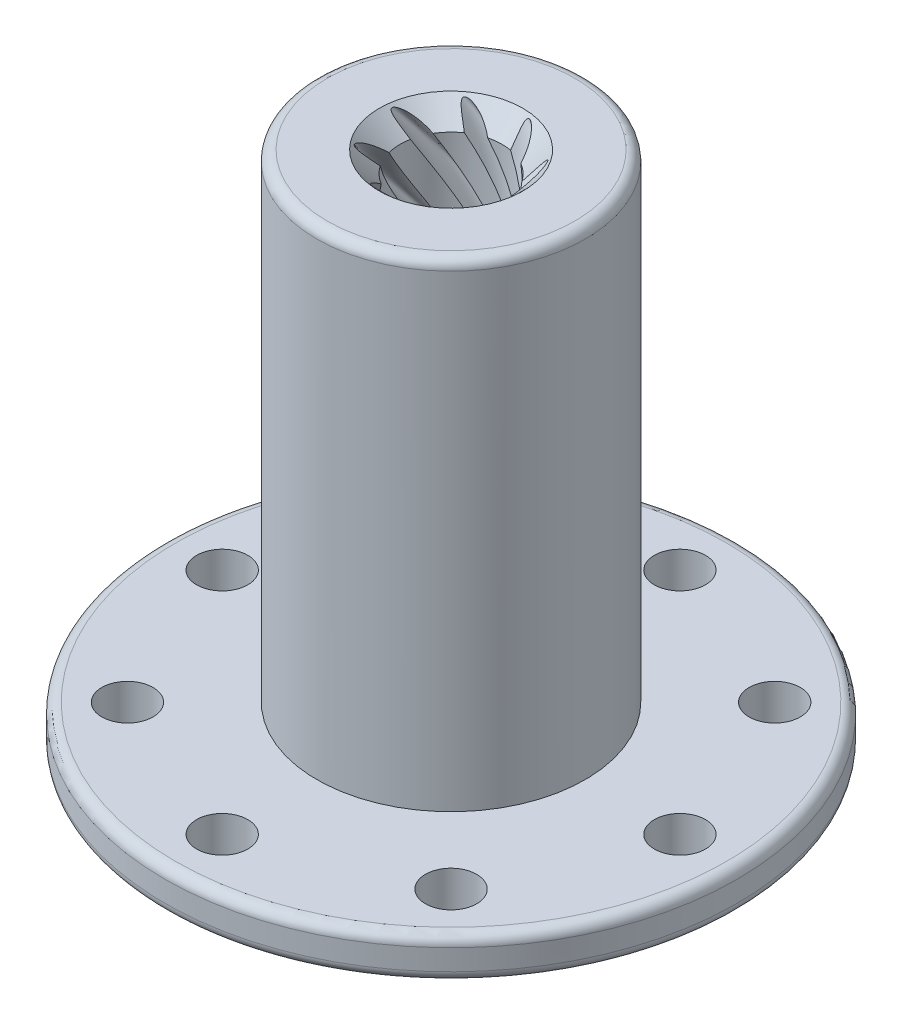
from build123d import *

# Parameters (mm, degrees)
CONG_1_R                                    = 0.5
ESQUISSE8_R                                 = 1.23
ENL_V_MAT_EXTRU_2_DEPTH                     = 31.118515945
R_P_TITION_CIRCULAIRE2_COUNT                = 8
ENL_VEMENT_DE_MATI_RE_BALAYAGE1_PITCH       = 25.4
ENL_VEMENT_DE_MATI_RE_BALAYAGE1_HEIGHT      = 25
ENL_VEMENT_DE_MATI_RE_BALAYAGE1_RADIUS      = 3.325
ENL_VEMENT_DE_MATI_RE_BALAYAGE1_START_ANGLE = 180
R_P_TITION_CIRCULAIRE1_COUNT                = 8


with BuildPart() as part:
    # Esquisse1 → Révolution2 (revolve)
    with BuildSketch(Plane.XY):
        Polygon((6.45, 25), (6.45, 2), (13.75, 2), (13.75, 0), (2.45, 0), (2.45, 24), (3.45, 25), align=None)
    revolve(axis=Axis((0, 0, 0), (0, 1, 0)))

    # Congé1
    cong_1_edges = [part.edges().sort_by_distance(p)[0] for p in [
        (-13.75, 0, 0),
        (-13.75, 2, 0),
        (-6.45, 25, 0),
    ]]
    fillet(cong_1_edges, radius=CONG_1_R)

    # Esquisse8 → Enlèv. mat.-Extru.2 (cut, through all)
    with BuildSketch(Plane(origin=(0, 2, 0), x_dir=(1, 0, 0), z_dir=(0, 1, 0))):
        with Locations((11, 0)):
            Circle(ESQUISSE8_R)
    enl_v_mat_extru_2 = extrude(amount=-ENL_V_MAT_EXTRU_2_DEPTH, mode=Mode.SUBTRACT)

    # Répétition circulaire2: Enlèv. mat.-Extru.2 ×8 about axis
    r_p_tition_circulaire2_axis = Axis((0, 0, 0), (0, -1, 0))
    for i in range(1, R_P_TITION_CIRCULAIRE2_COUNT):
        add(enl_v_mat_extru_2.rotate(r_p_tition_circulaire2_axis, i * 360 / R_P_TITION_CIRCULAIRE2_COUNT), mode=Mode.SUBTRACT)

    # Enlèvement de matière-Balayage1: sweep along a helix
    with BuildLine() as enl_vement_de_mati_re_balayage1_path:
        add(Helix(ENL_VEMENT_DE_MATI_RE_BALAYAGE1_PITCH, ENL_VEMENT_DE_MATI_RE_BALAYAGE1_HEIGHT, ENL_VEMENT_DE_MATI_RE_BALAYAGE1_RADIUS, center=(0, 0, 0), direction=(0, 1, 0), mode=Mode.PRIVATE).rotate(Axis((0, 0, 0), (0, 1, 0)), ENL_VEMENT_DE_MATI_RE_BALAYAGE1_START_ANGLE))
    # Esquisse11 → Enlèvement de matière-Balayage1 (sweep, cut)
    with BuildSketch(Plane.XY):
        with BuildLine():
            Line((2.324477405, 19.852026425), (2.324477405, 18.352026425))
            add(Edge.make_bspline(
                [(2.324477405, 18.352026425), (4.324477405, 19.102026425), (2.324477405, 19.852026425)],
                knots=[0, 0, 0, 1, 1, 1], degree=2))
        make_face()
    enl_vement_de_mati_re_balayage1 = sweep(path=enl_vement_de_mati_re_balayage1_path.line, is_frenet=True, mode=Mode.SUBTRACT)

    # Répétition circulaire1: Enlèvement de matière-Balayage1 ×8 about axis
    r_p_tition_circulaire1_axis = Axis((0, 0, 0), (0, -1, 0))
    for i in range(1, R_P_TITION_CIRCULAIRE1_COUNT):
        add(enl_vement_de_mati_re_balayage1.rotate(r_p_tition_circulaire1_axis, i * 360 / R_P_TITION_CIRCULAIRE1_COUNT), mode=Mode.SUBTRACT)


solid = part.part
